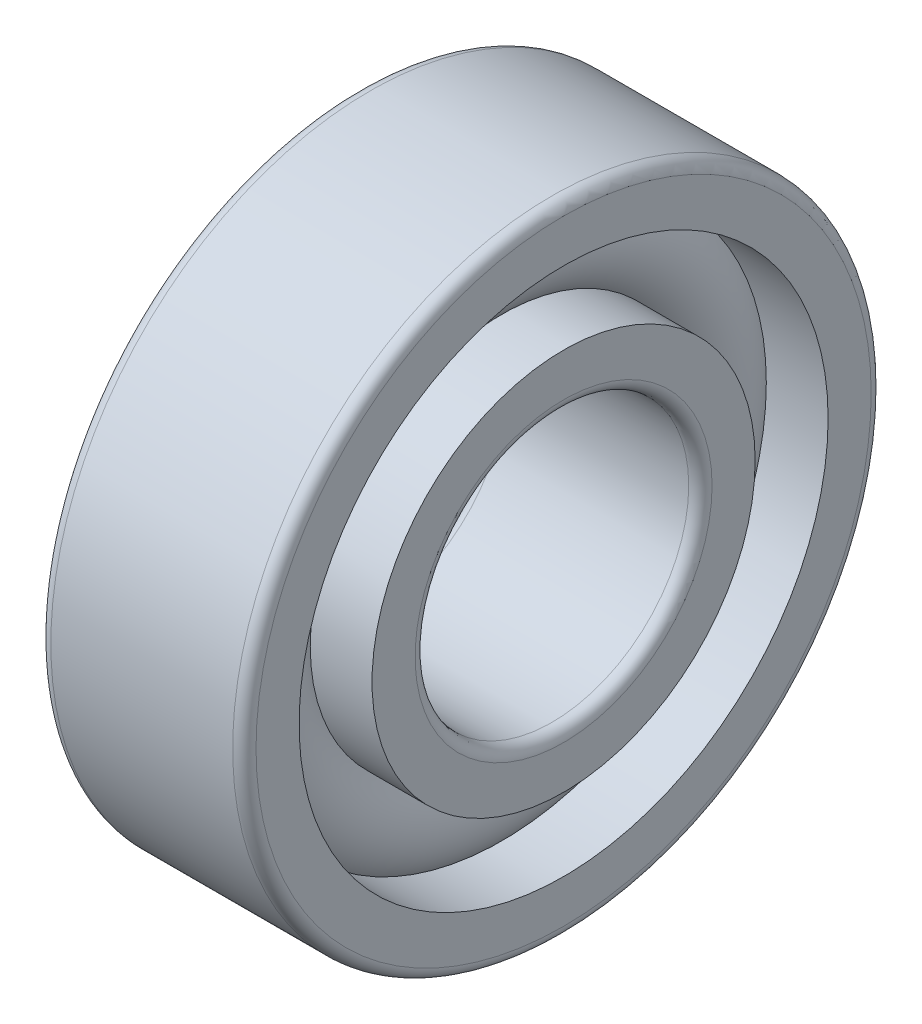
from build123d import *

# Parameters (mm, degrees)
CAGSPISKE_W     = 0.381
CAGSPISKE_H     = 0.635
CAGESPINE_ANGLE = 0.001
BALSIMSKE_R     = 1.905


with BuildPart() as part:
    # CagSpiSke → CageSpine (revolve)
    with BuildSketch(Plane.XY):
        with Locations((0, 7.9375)):
            Rectangle(CAGSPISKE_W, CAGSPISKE_H)
    revolve(axis=Axis((-20.6375, 0, 0), (-1, 0, 0)), revolution_arc=CAGESPINE_ANGLE)

    # BalSimSke → BallsSimplified (revolve)
    with BuildSketch(Plane.XY):
        with Locations((0, 7.9375)):
            Circle(BALSIMSKE_R)
    revolve(axis=Axis((-10, 0, 0), (1, 0, 0)))

    # InnRacSke → InnerRace (revolve)
    with BuildSketch(Plane.XY):
        with BuildLine():
            Line((-1.36023926, 6.6675), (-3.57124, 6.6675))
            Line((-3.57124, 6.6675), (-3.57124, 5.1689))
            ThreePointArc((-3.57124, 5.1689), (-3.452208196, 4.881531804), (-3.16484, 4.7625))
            Line((-3.16484, 4.7625), (3.16484, 4.7625))
            ThreePointArc((3.16484, 4.7625), (3.452208196, 4.881531804), (3.57124, 5.1689))
            Line((3.57124, 5.1689), (3.57124, 6.6675))
            Line((3.57124, 6.6675), (1.41103926, 6.6675))
            ThreePointArc((1.41103926, 6.6675), (0.0254, 6.0579), (-1.36023926, 6.6675))
        make_face()
    revolve(axis=Axis((-20.6375, 0, 0), (1, 0, 0)))

    # OutRacSke → OuterRace (revolve)
    with BuildSketch(Plane.XY):
        with BuildLine():
            Line((-1.38563926, 9.2075), (-3.57124, 9.2075))
            Line((-3.57124, 9.2075), (-3.57124, 10.7061))
            ThreePointArc((-3.57124, 10.7061), (-3.452208196, 10.993468196), (-3.16484, 11.1125))
            Line((-3.16484, 11.1125), (3.16484, 11.1125))
            ThreePointArc((3.16484, 11.1125), (3.452208196, 10.993468196), (3.57124, 10.7061))
            Line((3.57124, 10.7061), (3.57124, 9.2075))
            Line((3.57124, 9.2075), (1.38563926, 9.2075))
            ThreePointArc((1.38563926, 9.2075), (0, 9.8171), (-1.38563926, 9.2075))
        make_face()
    revolve(axis=Axis((-20.6375, 0, 0), (1, 0, 0)))


solid = part.part
